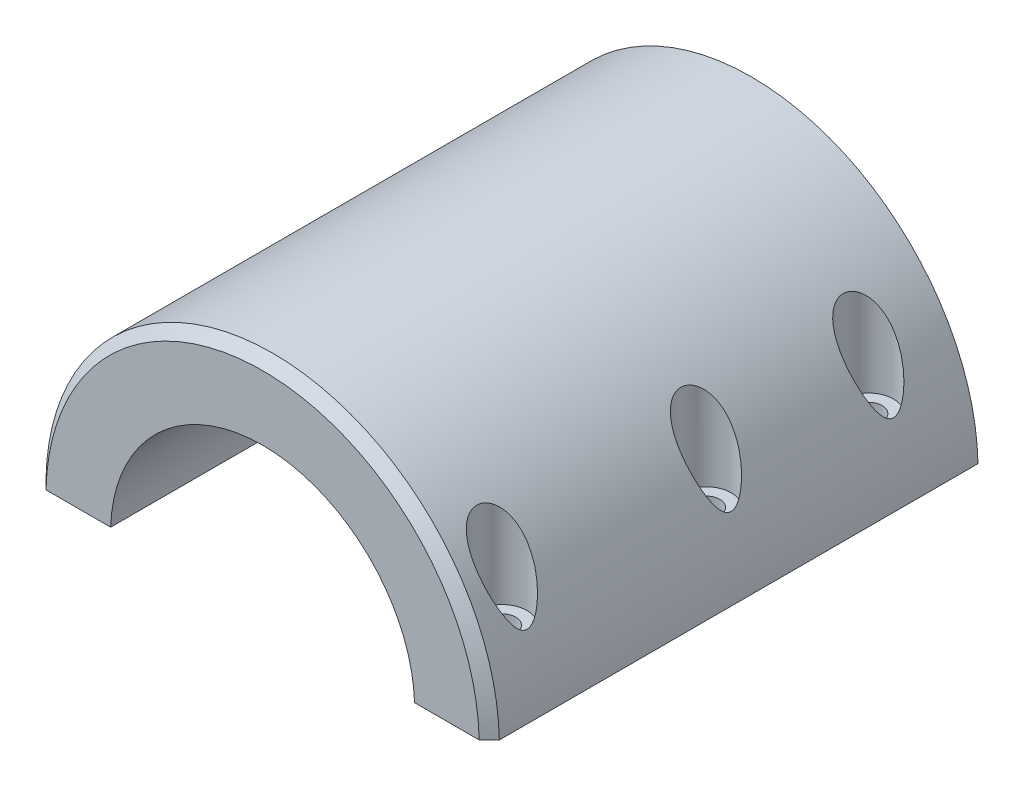
from build123d import *

# Parameters (mm, degrees)
EXTRUDE_1_DEPTH      = 97
CHAMFER_1_SIZE       = 2
SKETCH_2_R           = 2.5
CUT_EXTRUDE_1_DEPTH  = 9
CHAMFER_2_SIZE       = 0.5
SKETCH_3_R           = 4.175
CUT_EXTRUDE_2_DEPTH  = 35.675
SKETCH_4_R           = 2.75
CUT_EXTRUDE_3_DEPTH  = 117.012930397
CUT_EXTRUDE_START    = -13
SKETCH_5_R           = 5
CUT_EXTRUDE_4_DEPTH  = 104.012930475
MOVE_FACE1_OUTLINE_W = 94
MOVE_FACE1_OUTLINE_H = 101
MOVE_FACE1_DEPTH     = 1


# Read off the part's stored shape, not the designer's step: Move Face1
with BuildPart() as part:
    # Эскиз1 → Бобышка-Вытянуть1 (new body)
    with BuildSketch(Plane.XY):
        with BuildLine():
            Line((-30.175, 0), (-45, 0))
            ThreePointArc((-45, 0), (0, 45), (45, 0))
            Line((45, 0), (30.175, 0))
            ThreePointArc((30.175, 0), (0, 30.175), (-30.175, 0))
        make_face()
    extrude(amount=EXTRUDE_1_DEPTH)

    # Фаска1
    chamfer_1_edges = [part.edges().sort_by_distance(p)[0] for p in [
        (0, 45, 97),
    ]]
    chamfer(chamfer_1_edges, length=CHAMFER_1_SIZE)

    # Эскиз2 → Вырез-Вытянуть1 (cut)
    with BuildSketch(Plane(origin=(0, 0, 0), x_dir=(-1, 0, 0), z_dir=(0, 0, -1))):
        with Locations((36.047313598, 10.336400843)):
            Circle(SKETCH_2_R)
        with Locations((23.087305325, 29.55040326)):
            Circle(SKETCH_2_R)
        with Locations((1.308731126, 37.477156013)):
            Circle(SKETCH_2_R)
        with Locations((-20.96973388, 31.088908971)):
            Circle(SKETCH_2_R)
        with Locations((-35.238473279, 12.825755375)):
            Circle(SKETCH_2_R)
    extrude(amount=-CUT_EXTRUDE_1_DEPTH, mode=Mode.SUBTRACT)

    # Фаска2
    chamfer_2_edges = [part.edges().sort_by_distance(p)[0] for p in [
        (-33.547313598, 10.336400843, 0),
        (-20.587305325, 29.55040326, 0),
        (1.191268874, 37.477156013, 0),
        (23.46973388, 31.088908971, 0),
        (37.738473279, 12.825755375, 0),
        (0, 30.175, 0),
    ]]
    chamfer(chamfer_2_edges, length=CHAMFER_2_SIZE)

    # Эскиз3 → Вырез-Вытянуть2 (cut)
    with BuildSketch(Plane(origin=(0, 0, 0), x_dir=(1, 0, 0), z_dir=(0, 1, 0))):
        with Locations(Location((0, -80, 0), (0, 0, 90))):
            Circle(SKETCH_3_R)
        with Locations(Location((0, -40, 0), (0, 0, 90))):
            Circle(SKETCH_3_R)
    extrude(amount=CUT_EXTRUDE_2_DEPTH, mode=Mode.SUBTRACT)

    # Эскиз4 → Вырез-Вытянуть3 (cut, through all)
    with BuildSketch(Plane.XZ):
        with Locations(Location((-37.5, 87, 0), (0, 0, 270))):
            Circle(SKETCH_4_R)
        with Locations(Location((37.5, 87, 0), (0, 0, 270))):
            Circle(SKETCH_4_R)
        with Locations(Location((-37.5, 46.5, 0), (0, 0, 270))):
            Circle(SKETCH_4_R)
        with Locations(Location((37.5, 46.5, 0), (0, 0, 270))):
            Circle(SKETCH_4_R)
        with Locations(Location((-37.5, 14.28, 0), (0, 0, 270))):
            Circle(SKETCH_4_R)
        with Locations(Location((37.5, 14.28, 0), (0, 0, 270))):
            Circle(SKETCH_4_R)
    extrude(amount=-CUT_EXTRUDE_3_DEPTH, mode=Mode.SUBTRACT)

    # Эскиз5 → Вырез-Вытянуть4 (cut, through all)
    with BuildSketch(Plane.XZ.offset(CUT_EXTRUDE_START)):
        with Locations(Location((-37.5, 87, 0), (0, 0, 270))):
            Circle(SKETCH_5_R)
        with Locations(Location((37.5, 87, 0), (0, 0, 270))):
            Circle(SKETCH_5_R)
        with Locations(Location((37.5, 46.5, 0), (0, 0, 270))):
            Circle(SKETCH_5_R)
        with Locations(Location((-37.5, 46.5, 0), (0, 0, 270))):
            Circle(SKETCH_5_R)
        with Locations(Location((-37.5, 14.28, 0), (0, 0, 270))):
            Circle(SKETCH_5_R)
        with Locations(Location((37.5, 14.28, 0), (0, 0, 270))):
            Circle(SKETCH_5_R)
    extrude(amount=-CUT_EXTRUDE_4_DEPTH, mode=Mode.SUBTRACT)

    # Move Face1 outline → Move Face1 (cut)
    with BuildSketch(Plane(origin=(0, 0, 0), x_dir=(1, 0, 0), z_dir=(0, 1, 0))):
        with Locations((0, -48.5)):
            Rectangle(MOVE_FACE1_OUTLINE_W, MOVE_FACE1_OUTLINE_H)
    extrude(amount=MOVE_FACE1_DEPTH, mode=Mode.SUBTRACT)


solid = part.part
